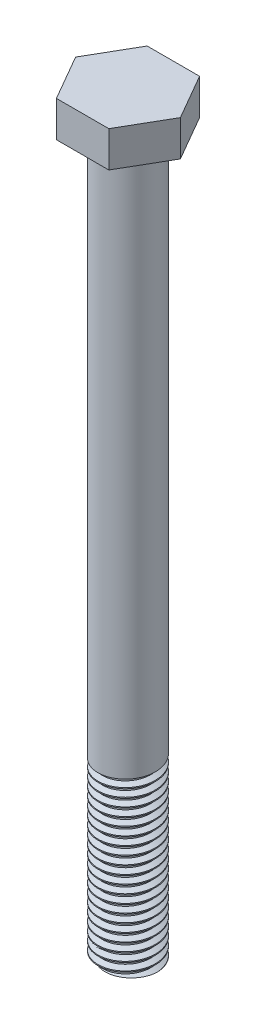
from build123d import *

# Parameters (mm, degrees)
SKETCH1_R           = 6
BOSS_EXTRUDE1_DEPTH = 150
BOSS_EXTRUDE2_DEPTH = 7.5
THREAD1_PITCH       = 1.75


with BuildPart() as part:
    # Sketch1 → Boss-Extrude1 (new body)
    with BuildSketch(Plane(origin=(0, 0, 0), x_dir=(1, 0, 0), z_dir=(0, 1, 0))):
        with Locations(Location((0, 0, 0), (0, 0, 270))):
            Circle(SKETCH1_R)
    extrude(amount=-BOSS_EXTRUDE1_DEPTH)

    # Sketch2 → Boss-Extrude2 (add)
    with BuildSketch(Plane(origin=(0, 0, 0), x_dir=(1, 0, 0), z_dir=(0, 1, 0))):
        Polygon((-5.484827557, -9.5), (5.484827557, -9.5), (10.969655115, 0), (5.484827557, 9.5), (-5.484827557, 9.5), (-10.969655115, 0), align=None)
    extrude(amount=BOSS_EXTRUDE2_DEPTH)

    # Thread1: the profile of Thread Profile1 profile screwed along a right-hand helix of 21.571429 turns, 10 arcs to a turn; built about Z, then put on its axis
    thread1_z = Axis((0, 0, 0), (0, 0, 1))
    thread1_corners = [(6.0003, 0, -0.000173205), (6.0003, 0, 1.5314232), (5.052784719, 0, 0.984374998), (5.052784719, 0, 0.546874998)]
    with BuildLine(mode=Mode.PRIVATE) as thread1_profile:
        Line(thread1_corners[0], thread1_corners[1])
        Line(thread1_corners[1], thread1_corners[2])
        Line(thread1_corners[2], thread1_corners[3])
        Line(thread1_corners[3], thread1_corners[0])
    thread1_cap = Face(thread1_profile.wire())
    thread1_turn_angles = [0, 18, 36, 54, 72, 90, 108, 126, 144, 162, 180, 198, 216, 234, 252, 270, 288, 306, 324, 342, 360]
    thread1_turn_weights = [1, 0.9510565162951535, 1, 0.9510565162951535, 1, 0.9510565162951535, 1, 0.9510565162951535, 1, 0.9510565162951535, 1, 0.9510565162951535, 1, 0.9510565162951535, 1, 0.9510565162951535, 1, 0.9510565162951535, 1, 0.9510565162951535, 1]
    thread1_turn_rails = [Edge.make_bspline([Vector(p[0], p[1], 0).rotate(thread1_z, thread1_turn_angles[k]) / thread1_turn_weights[k] + Vector(0, 0, p[2] + THREAD1_PITCH * thread1_turn_angles[k] / 360) for k in range(21)], [0, 0, 0, 1, 1, 2, 2, 3, 3, 4, 4, 5, 5, 6, 6, 7, 7, 8, 8, 9, 9, 10, 10, 10], 2, thread1_turn_weights) for p in thread1_corners]
    thread1_turn_sides = [Face.make_surface_from_curves(thread1_turn_rails[p[0]], thread1_turn_rails[p[1]]) for p in [(0, 1), (1, 2), (2, 3), (3, 0)]]
    thread1_last_angles = [7560, 7578, 7596, 7614, 7632, 7650, 7668, 7686, 7704, 7722, 7740, 7752.857142857, 7765.714285714]
    thread1_last_weights = [1, 0.9510565162951535, 1, 0.9510565162951535, 1, 0.9510565162951535, 1, 0.9510565162951535, 1, 0.9510565162951535, 1, 0.9749279121818244, 1]
    thread1_last_rails = [Edge.make_bspline([Vector(p[0], p[1], 0).rotate(thread1_z, thread1_last_angles[k]) / thread1_last_weights[k] + Vector(0, 0, p[2] + THREAD1_PITCH * thread1_last_angles[k] / 360) for k in range(13)], [0, 0, 0, 1, 1, 2, 2, 3, 3, 4, 4, 5, 5, 6, 6, 6], 2, thread1_last_weights) for p in thread1_corners]
    thread1_last_sides = [Face.make_surface_from_curves(thread1_last_rails[p[0]], thread1_last_rails[p[1]]) for p in [(0, 1), (1, 2), (2, 3), (3, 0)]]
    thread1 = Plane(origin=(0, -151.75, 0), x_dir=(1, 0, 0), z_dir=(0, 1, 0)) * Solid(Shell([*[p.moved(Location((0, 0, THREAD1_PITCH * i))) for i in range(21) for p in thread1_turn_sides], *thread1_last_sides, thread1_cap, thread1_cap.rotate(thread1_z, 7765.714285714).moved(Location((0, 0, THREAD1_PITCH * 7765.714285714 / 360)))]))
    add(thread1, mode=Mode.SUBTRACT)


solid = part.part
